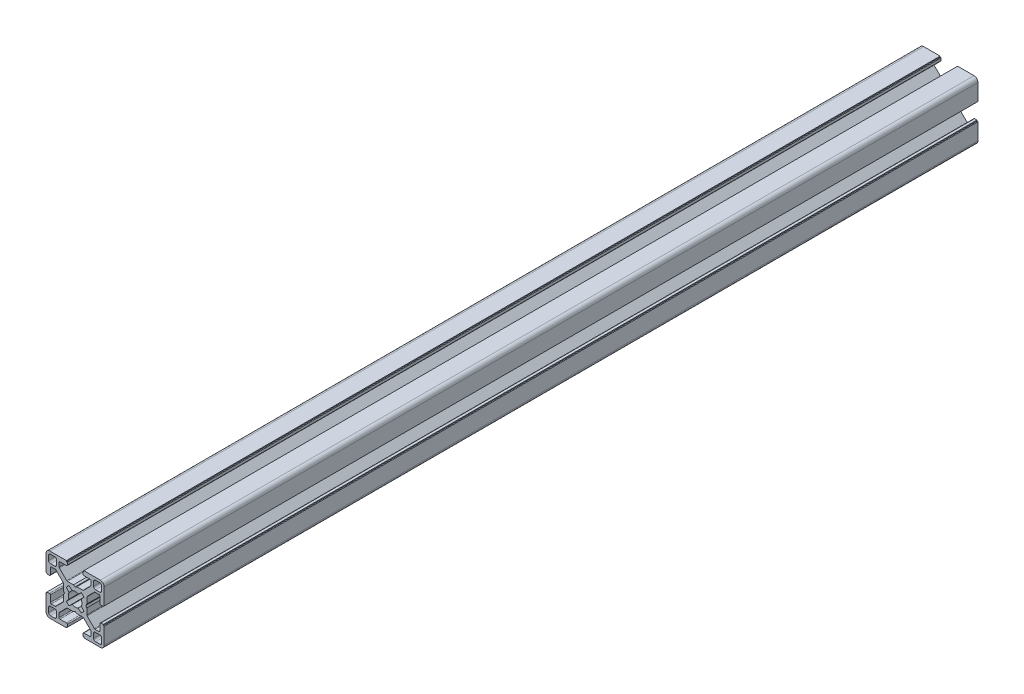
from build123d import *

# Parameters (mm, degrees)
BOSS_EXTRUDE1_DEPTH = 225
CIRPATTERN1_COUNT   = 4


with BuildPart() as part:
    # Sketch3 → Boss-Extrude1 (new, symmetric)
    with BuildSketch(Plane.XY):
        with BuildLine():
            Line((-4.503841895, 3.156803476), (-3.14772708, 1.530298739))
            ThreePointArc((-3.14772708, 1.530298739), (-3.410794979, 0.785160882), (-3.5, 0))
            Line((-3.5, 0), (-5.5, 0))
            Line((-5.5, 0), (-6, 0.866025404))
            Line((-6, 0.866025404), (-6, 3.996841995))
            ThreePointArc((-6, 3.996841995), (-6.038060234, 4.188183711), (-6.146446609, 4.350395385))
            Line((-6.146446609, 4.350395385), (-9.917104615, 8.121053391))
            ThreePointArc((-9.917104615, 8.121053391), (-10.079316289, 8.229439766), (-10.270658005, 8.2675))
            Line((-10.270658005, 8.2675), (-12.29, 8.2675))
            ThreePointArc((-12.29, 8.2675), (-12.643553391, 8.121053391), (-12.79, 7.7675))
            Line((-12.79, 7.7675), (-12.79, 4.5))
            ThreePointArc((-12.79, 4.5), (-12.936446609, 4.146446609), (-13.29, 4))
            Line((-13.29, 4), (-14.5, 4))
            Line((-14.5, 4), (-14.5, 4.5))
            Line((-14.5, 4.5), (-15, 4.5))
            Line((-15, 4.5), (-15, 12.968))
            ThreePointArc((-15, 12.968), (-14.404840979, 14.404840979), (-12.968, 15))
            Line((-12.968, 15), (-4.5, 15))
            Line((-4.5, 15), (-4.5, 14.5))
            Line((-4.5, 14.5), (-4, 14.5))
            Line((-4, 14.5), (-4, 13.29))
            ThreePointArc((-4, 13.29), (-4.146446609, 12.936446609), (-4.5, 12.79))
            Line((-4.5, 12.79), (-7.7675, 12.79))
            ThreePointArc((-7.7675, 12.79), (-8.121053391, 12.643553391), (-8.2675, 12.29))
            Line((-8.2675, 12.29), (-8.2675, 10.270658005))
            ThreePointArc((-8.2675, 10.270658005), (-8.229439766, 10.079316289), (-8.121053391, 9.917104615))
            Line((-8.121053391, 9.917104615), (-4.350395385, 6.146446609))
            ThreePointArc((-4.350395385, 6.146446609), (-4.188183711, 6.038060234), (-3.996841995, 6))
            Line((-3.996841995, 6), (-0.866025404, 6))
            Line((-0.866025404, 6), (0, 5.5))
            Line((0, 5.5), (0, 3.5))
            ThreePointArc((0, 3.5), (-0.785160882, 3.410794979), (-1.530298739, 3.14772708))
            Line((-1.530298739, 3.14772708), (-3.156803476, 4.503841895))
            ThreePointArc((-3.156803476, 4.503841895), (-3.889087297, 3.889087297), (-4.503841895, 3.156803476))
        make_face()
        with BuildLine():
            Line((-12.705, 9.5135), (-10.5135, 9.5135))
            ThreePointArc((-10.5135, 9.5135), (-9.806393219, 9.806393219), (-9.5135, 10.5135))
            Line((-9.5135, 10.5135), (-9.5135, 12.705))
            ThreePointArc((-9.5135, 12.705), (-9.806393219, 13.412106781), (-10.5135, 13.705))
            Line((-10.5135, 13.705), (-12.705, 13.705))
            ThreePointArc((-12.705, 13.705), (-13.412106781, 13.412106781), (-13.705, 12.705))
            Line((-13.705, 12.705), (-13.705, 10.5135))
            ThreePointArc((-13.705, 10.5135), (-13.412106781, 9.806393219), (-12.705, 9.5135))
        make_face(mode=Mode.SUBTRACT)
    boss_extrude1 = extrude(amount=BOSS_EXTRUDE1_DEPTH, both=True)

    # CirPattern1: Boss-Extrude1 ×4 about axis
    cirpattern1_axis = Axis((0, 0, 76.2), (0, 0, -1))
    for i in range(1, CIRPATTERN1_COUNT):
        add(boss_extrude1.rotate(cirpattern1_axis, i * 360 / CIRPATTERN1_COUNT))


solid = part.part
